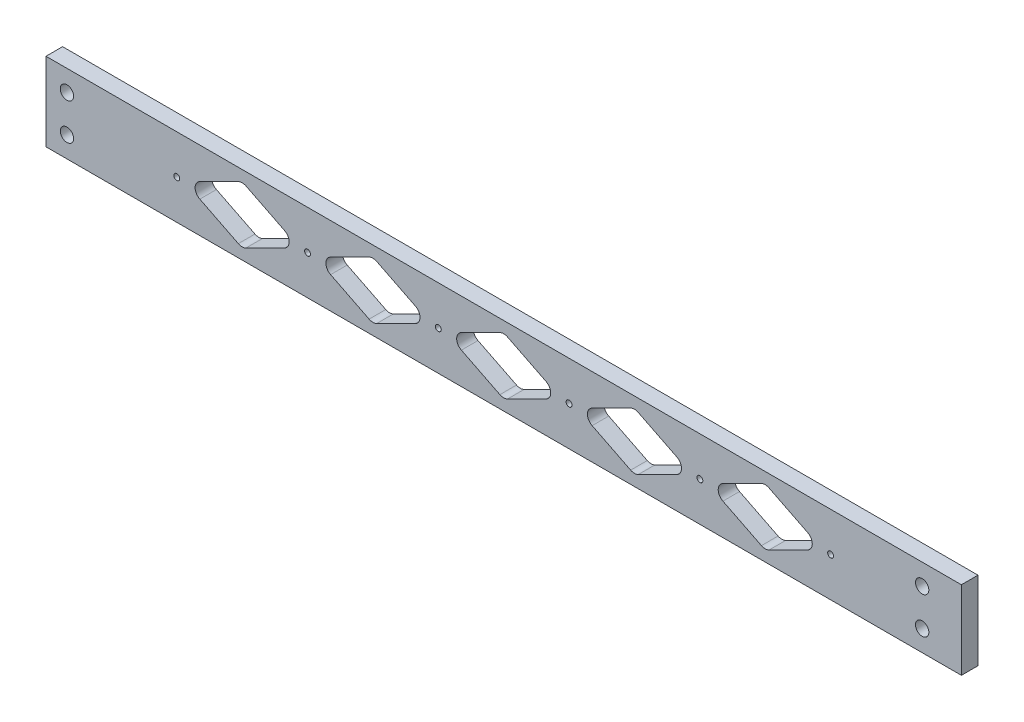
from build123d import *

# Parameters (mm, degrees)
SKETCH2_W                   = 350
SKETCH2_H                   = 30
BOSS_EXTRUDE1_DEPTH         = 6.35
TAP_DRILL_FOR_1_4_20_TAP2_D = 5.1054
TAP_DRILL_FOR_4_40_TAP1_D   = 2.2606
LPATTERN1_COUNT             = 6
LPATTERN1_PITCH             = 50
TAP_DRILL_FOR_1_4_20_TAP1_D = 5.1054
CUT_EXTRUDE1_DEPTH          = 352.340749843
FILLET1_R                   = 3.25
LPATTERN2_COUNT             = 5
LPATTERN2_PITCH             = 50
FILLET1_OF_LPATTERN2_R      = 3.25


with BuildPart() as part:
    # Sketch2 → Boss-Extrude1 (new body)
    with BuildSketch(Plane.XY):
        with Locations((175, 15)):
            Rectangle(SKETCH2_W, SKETCH2_H)
    extrude(amount=BOSS_EXTRUDE1_DEPTH)

    # Tap Drill for 1/4-20 Tap2 (through all)
    with Locations(Plane.XY.offset(6.35)):
        with Locations((8, 22), (8, 8)):
            Hole(TAP_DRILL_FOR_1_4_20_TAP2_D / 2)

    # Tap Drill for #4-40 Tap1 (through all)
    with Locations(Plane.XY.offset(6.35)):
        with Locations((50, 15)):
            tap_drill_for_4_40_tap1 = Hole(TAP_DRILL_FOR_4_40_TAP1_D / 2)

    # LPattern1: Tap Drill for #4-40 Tap1 ×6
    with Locations(*[(i * LPATTERN1_PITCH, 0, 0) for i in range(1, LPATTERN1_COUNT)]):
        add(tap_drill_for_4_40_tap1, mode=Mode.SUBTRACT)

    # Tap Drill for 1/4-20 Tap1 (through all)
    with Locations(Plane(origin=(0, 0, 0), x_dir=(-1, 0, 0), z_dir=(0, 0, -1))):
        with Locations((-335, 22), (-335, 8)):
            Hole(TAP_DRILL_FOR_1_4_20_TAP1_D / 2)

    # Sketch13 → Cut-Extrude1 (cut, through all)
    with BuildSketch(Plane(origin=(0, 0, 0), x_dir=(-1, 0, 0), z_dir=(0, 0, -1))):
        Polygon((-75, 26), (-97, 15), (-75, 4), (-53, 15), align=None)
    cut_extrude1 = extrude(amount=-CUT_EXTRUDE1_DEPTH, mode=Mode.SUBTRACT)

    # Fillet1
    fillet1_edges = [part.edges().sort_by_distance(p)[0] for p in [
        (53, 15, 3.175),
        (75, 4, 3.175),
        (97, 15, 3.175),
        (75, 26, 3.175),
    ]]
    fillet(fillet1_edges, radius=FILLET1_R)

    # LPattern2: Cut-Extrude1 ×5
    with Locations(*[(i * LPATTERN2_PITCH, 0, 0) for i in range(1, LPATTERN2_COUNT)]):
        add(cut_extrude1, mode=Mode.SUBTRACT)

    # Fillet1 of LPattern2
    fillet1_of_lpattern2_edges = [part.edges().sort_by_distance(p)[0] for p in [
        (103, 15, 3.175),
        (125, 4, 3.175),
        (147, 15, 3.175),
        (125, 26, 3.175),
        (153, 15, 3.175),
        (175, 4, 3.175),
        (197, 15, 3.175),
        (175, 26, 3.175),
        (203, 15, 3.175),
        (225, 4, 3.175),
        (247, 15, 3.175),
        (225, 26, 3.175),
        (253, 15, 3.175),
        (275, 4, 3.175),
        (297, 15, 3.175),
        (275, 26, 3.175),
    ]]
    fillet(fillet1_of_lpattern2_edges, radius=FILLET1_OF_LPATTERN2_R)


solid = part.part
